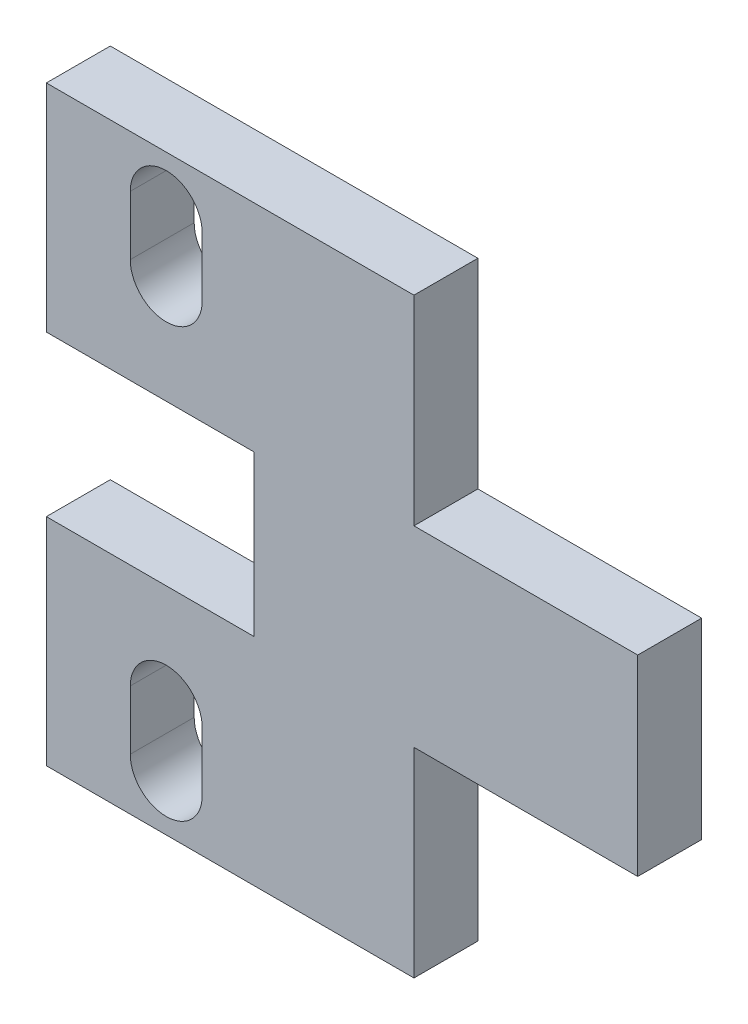
from build123d import *

# Parameters (mm, degrees)
BOSS_EXTRUDE1_DEPTH      = 2
M4_START                 = -2
M4_CLEARANCE_SLOT1_DEPTH = 4


# Read off the part's stored shape, not the designer's step: M4 Clearance Slot1
with BuildPart() as part:
    # Sketch1 → Boss-Extrude1 (new, symmetric)
    with BuildSketch(Plane.XY):
        Polygon((0, 0), (0, -5), (-13, -5), (-13, -18.5), (10, -18.5), (10, -6), (24, -6), (24, 0), align=None)
    boss_extrude1 = extrude(amount=BOSS_EXTRUDE1_DEPTH, both=True)

    # M4 Clearance Slot1 outline → M4 Clearance Slot1 (cut)
    with BuildSketch(Plane.XY.offset(M4_START)):
        with BuildLine():
            Line((-7.75, -11.55), (-7.75, -15.25))
            ThreePointArc((-7.75, -15.25), (-5.5, -17.5), (-3.25, -15.25))
            Line((-3.25, -15.25), (-3.25, -11.55))
            ThreePointArc((-3.25, -11.55), (-5.5, -9.3), (-7.75, -11.55))
        make_face()
    m4_clearance_slot1 = extrude(amount=M4_CLEARANCE_SLOT1_DEPTH, mode=Mode.SUBTRACT)

    # Mirror2: Boss-Extrude1, M4 Clearance Slot1 across plane
    add(boss_extrude1.mirror(Plane.ZX))
    add(m4_clearance_slot1.mirror(Plane.ZX), mode=Mode.SUBTRACT)


solid = part.part
